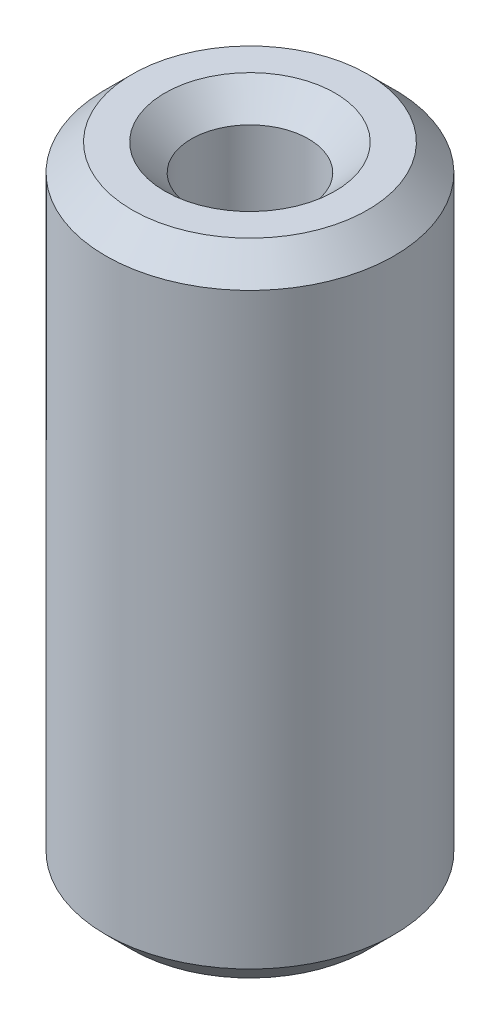
from build123d import *

# Parameters (mm, degrees)
SKETCH1_R           = 20
BOSS_EXTRUDE1_DEPTH = 88.859881316
SKETCH2_R           = 8.124300364
CUT_EXTRUDE1_DEPTH  = 94.252766755
CHAMFER1_SIZE       = 3.675849753


with BuildPart() as part:
    # Sketch1 → Boss-Extrude1 (new body)
    with BuildSketch(Plane(origin=(0, 0, 0), x_dir=(1, 0, 0), z_dir=(0, 1, 0))):
        Circle(SKETCH1_R)
    extrude(amount=BOSS_EXTRUDE1_DEPTH)

    # Sketch2 → Cut-Extrude1 (cut, through all)
    with BuildSketch(Plane(origin=(0, 0, 0), x_dir=(1, 0, 0), z_dir=(0, 1, 0))):
        Circle(SKETCH2_R)
    extrude(amount=CUT_EXTRUDE1_DEPTH, mode=Mode.SUBTRACT)

    # Chamfer1
    chamfer1_edges = [part.edges().sort_by_distance(p)[0] for p in [
        (-8.124300364, 88.859881316, 0),
        (-8.124300364, 0, 0),
        (-20, 0, 0),
        (-20, 88.859881316, 0),
    ]]
    chamfer(chamfer1_edges, length=CHAMFER1_SIZE)


solid = part.part
